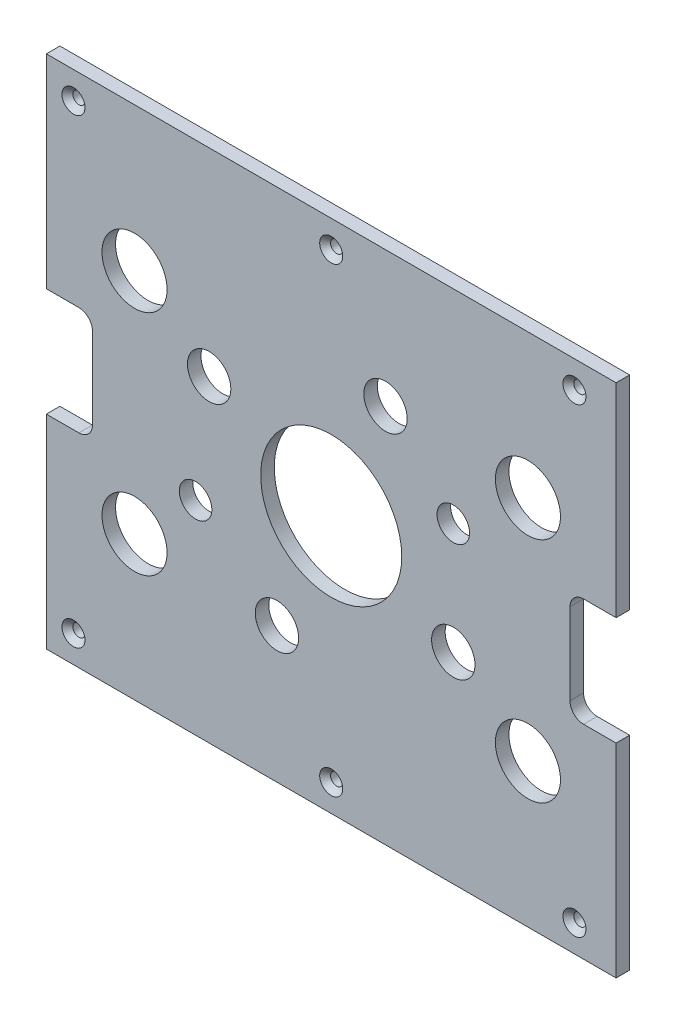
from build123d import *

# Parameters (mm, degrees)
SKETCH_1_W          = 210
SKETCH_1_H          = 190
EXTRUDE_1_DEPTH     = 5
SKETCH_2_R          = 26
SKETCH_2_R_2        = 8
SKETCH_2_R_3        = 12
SKETCH_2_R_4        = 6
CUT_EXTRUDE_1_DEPTH = 142.686273153
SKETCH_5_W          = 20
SKETCH_5_H          = 40
CUT_EXTRUDE_2_DEPTH = 142.686273153
FILLET_1_R          = 5


# Read off the part's stored shape, not the designer's step: ｽｹｯﾁ-ﾊﾟﾀｰﾝ1
with BuildPart() as part:
    # ｽｹｯﾁ1 → ﾎﾞｽ - 押し出し1 (new body)
    with BuildSketch(Plane.XY):
        Rectangle(SKETCH_1_W, SKETCH_1_H)
    extrude(amount=EXTRUDE_1_DEPTH)

    # ｽｹｯﾁ2 → ｶｯﾄ - 押し出し1 (cut, through all)
    with BuildSketch(Plane.XY):
        Circle(SKETCH_2_R)
        with Locations((20, 45)):
            Circle(SKETCH_2_R_2)
        with Locations((-45, 22)):
            Circle(SKETCH_2_R_2)
        with Locations((-20, -45)):
            Circle(SKETCH_2_R_2)
        with Locations((45, -21)):
            Circle(SKETCH_2_R_2)
        with Locations((-72.5, 42)):
            Circle(SKETCH_2_R_3)
        with Locations((-72.5, -42)):
            Circle(SKETCH_2_R_3)
        with Locations((72.5, -42)):
            Circle(SKETCH_2_R_3)
        with Locations((72.5, 42)):
            Circle(SKETCH_2_R_3)
        with Locations((-50, -20)):
            Circle(SKETCH_2_R_4)
        with Locations((45, 20)):
            Circle(SKETCH_2_R_4)
    extrude(amount=CUT_EXTRUDE_1_DEPTH, mode=Mode.SUBTRACT)


with BuildPart() as body_2:
    # ｽｹｯﾁ3 → 回転1 (revolve)
    with BuildSketch(Plane(origin=(0, 0, 0), x_dir=(0, 0, -1), z_dir=(1, 0, 0)), mode=Mode.PRIVATE) as revolve_1_sk:
        Polygon((3, 85), (3, 87.25), (-3, 87.25), (-10, 94.25), (-10, 85), align=None)
    revolve(revolve_1_sk.sketch.rotate(Axis((0, 85, -14.033072833), (0, 0, 1)), 90), axis=Axis((0, 85, -14.033072833), (0, 0, 1)))


with BuildPart() as body_3:
    # ｽｹｯﾁ-ﾊﾟﾀｰﾝ1 outline → ｽｹｯﾁ-ﾊﾟﾀｰﾝ1 (revolve)
    with BuildSketch(Plane(origin=(89.651938965, -85, 0), x_dir=(1, 0, 0), z_dir=(0, -1, 0))):
        Polygon((0, 10), (0, -3), (2.25, -3), (2.25, 3), (9.25, 10), align=None)
    revolve(axis=Axis((89.651938965, -85, 0), (0, 0, 1)))


with BuildPart() as body_4:
    # Pattern Sketch 1 2 outline → Pattern Sketch 1 2 (revolve)
    with BuildSketch(Plane(origin=(89.651938965, 85, 0), x_dir=(1, 0, 0), z_dir=(0, -1, 0))):
        Polygon((0, 10), (0, -3), (2.25, -3), (2.25, 3), (9.25, 10), align=None)
    revolve(axis=Axis((89.651938965, 85, 0), (0, 0, 1)))


with BuildPart() as body_5:
    # Pattern Sketch 1 3 outline → Pattern Sketch 1 3 (revolve)
    with BuildSketch(Plane.XZ.offset(85)):
        Polygon((0, 10), (0, -3), (2.25, -3), (2.25, 3), (9.25, 10), align=None)
    revolve(axis=Axis((0, -85, 0), (0, 0, 1)))


with BuildPart() as body_6:
    # Pattern Sketch 1 4 outline → Pattern Sketch 1 4 (revolve)
    with BuildSketch(Plane(origin=(-95, -85, 0), x_dir=(1, 0, 0), z_dir=(0, -1, 0))):
        Polygon((0, 10), (0, -3), (2.25, -3), (2.25, 3), (9.25, 10), align=None)
    revolve(axis=Axis((-95, -85, 0), (0, 0, 1)))


with BuildPart() as body_7:
    # Pattern Sketch 1 5 outline → Pattern Sketch 1 5 (revolve)
    with BuildSketch(Plane(origin=(-95, 85, 0), x_dir=(1, 0, 0), z_dir=(0, -1, 0))):
        Polygon((0, 10), (0, -3), (2.25, -3), (2.25, 3), (9.25, 10), align=None)
    revolve(axis=Axis((-95, 85, 0), (0, 0, 1)))


with BuildPart() as part_1:
    add(part.part)

    # Combine 1: cut body 7, body 6, body 5, body 2, body 4, body 3
    add(body_7.part, mode=Mode.SUBTRACT)
    add(body_6.part, mode=Mode.SUBTRACT)
    add(body_5.part, mode=Mode.SUBTRACT)
    add(body_2.part, mode=Mode.SUBTRACT)
    add(body_4.part, mode=Mode.SUBTRACT)
    add(body_3.part, mode=Mode.SUBTRACT)

    # ｽｹｯﾁ5 → ｶｯﾄ - 押し出し2 (cut, through all)
    with BuildSketch(Plane.XY):
        with Locations((-98, 0)):
            Rectangle(SKETCH_5_W, SKETCH_5_H)
        with Locations((98, 0)):
            Rectangle(SKETCH_5_W, SKETCH_5_H)
    extrude(amount=CUT_EXTRUDE_2_DEPTH, mode=Mode.SUBTRACT)

    # ﾌｨﾚｯﾄ1
    fillet_1_edges = [part_1.edges().sort_by_distance(p)[0] for p in [
        (88, -20, 2.5),
        (88, 20, 2.5),
        (-88, 20, 2.5),
        (-88, -20, 2.5),
    ]]
    fillet(fillet_1_edges, radius=FILLET_1_R)


solid = part_1.part
